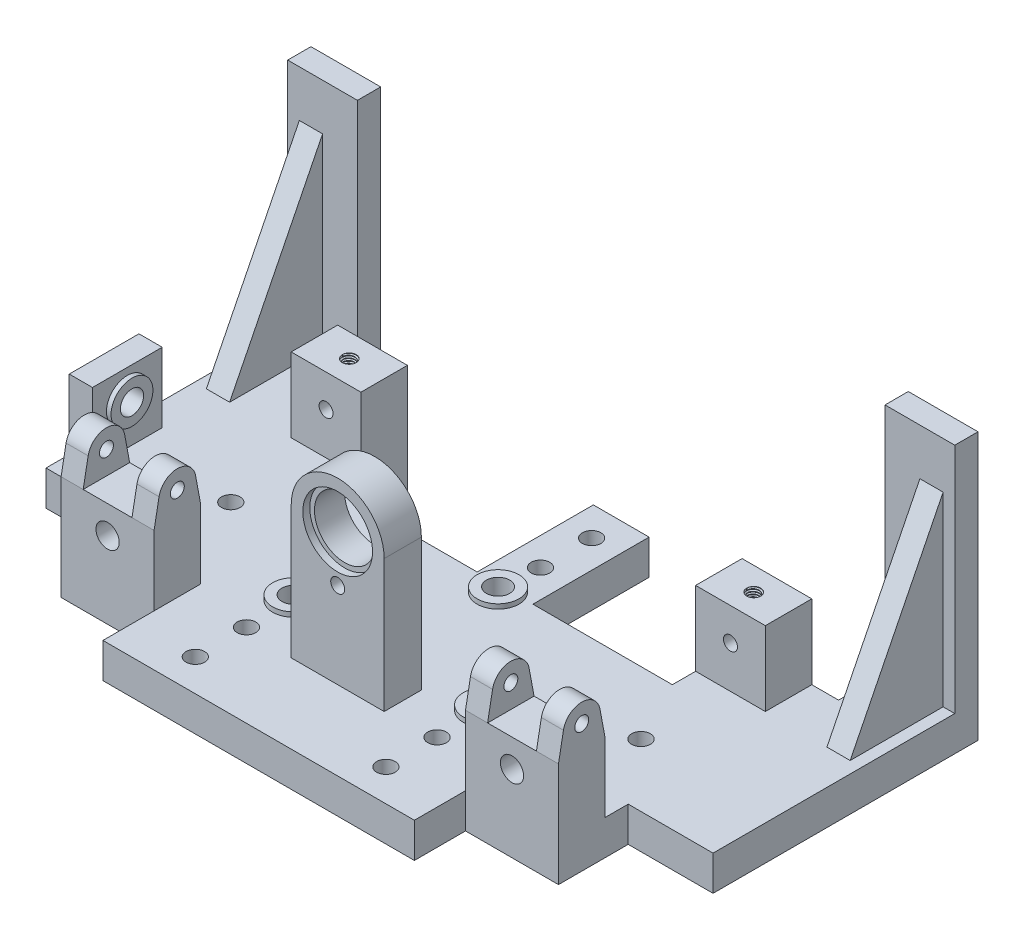
from build123d import *
from build123d.topology import SkipClean

# Parameters (mm, degrees)
EXTRUDE_1_DEPTH          = 15
SKETCH_3_W               = 10
SKETCH_3_H               = 30
EXTRUDE_2_DEPTH          = 30
SKETCH_5_W               = 40
SKETCH_5_H               = 20
EXTRUDE_3_DEPTH          = 30
SKETCH_2_R               = 5
CUT_EXTRUDE_1_DEPTH      = 13
CUT_EXTRUDE_2_REACH      = 323.076
SKETCH_4_R               = 5
CUT_EXTRUDE_3_REACH      = 190.715
SKETCH_6_R               = 5
EXTRUDE_START            = 2
SKETCH_7_R               = 9
SKETCH_7_R_2             = 5
EXTRUDE_4_DEPTH          = 2
SKETCH_8_R               = 9
SKETCH_8_R_2             = 5
EXTRUDE_5_DEPTH          = 2
SKETCH_9_R               = 9
SKETCH_9_R_2             = 5
EXTRUDE_6_DEPTH          = 2
SKETCH_11_W              = 40
SKETCH_11_H              = 16
EXTRUDE_7_DEPTH          = 57
SKETCH_12_W              = 20
SKETCH_12_H              = 16
REVOLVE_1_ANGLE          = 180
CUT_EXTRUDE_5_DEPTH      = 210.619297776
CUT_EXTRUDE_5_DEPTH_BACK = 3
SKETCH_13_R              = 15
CUT_EXTRUDE_6_REACH      = 209.888
SKETCH_14_R              = 13
SKETCH_15_R              = 3
CUT_EXTRUDE_7_DEPTH      = 12
SKETCH_10_R              = 4
CUT_EXTRUDE_4_DEPTH      = 226.51552053
EXTRUDE_8_DEPTH          = 40
CUT_EXTRUDE_8_REACH      = 251.153
SKETCH_17_W              = 20
SKETCH_17_H              = 21
SKETCH_18_R              = 3
CUT_EXTRUDE_9_DEPTH      = 40
SKETCH_19_W              = 30
SKETCH_19_H              = 20
EXTRUDE_9_DEPTH          = 32
SKETCH_20_R              = 3
CUT_EXTRUDE_10_DEPTH     = 20
SKETCH_21_W              = 30
SKETCH_21_H              = 15
EXTRUDE_10_DEPTH         = 30
SKETCH_22_W              = 30
SKETCH_22_H              = 10
EXTRUDE_11_DEPTH         = 100
SKETCH_24_R              = 3
CUT_EXTRUDE_12_DEPTH     = 10
RIB_1_REACH              = 344.797
SKETCH_25_WALL_W         = 777.037351518
SKETCH_25_WALL_H         = 10
THREAD_1_PITCH           = 1
THREAD_2_PITCH           = 1


with BuildPart() as part:
    # Sketch 1 → 凸台-拉伸1 (new body)
    with BuildSketch(Plane(origin=(0, 0, 0), x_dir=(1, 0, 0), z_dir=(0, 1, 0))):
        Polygon((-67, 0), (67, 0), (67, 22), (107, 22), (107, 52), (143.5, 52), (143.5, 136), (72, 136), (72, 106), (12, 106), (12, 156), (-12, 156), (-12, 106), (-72, 106), (-72, 136), (-143.5, 136), (-143.5, 52), (-107, 52), (-107, 22), (-67, 22), align=None)
    extrude(amount=EXTRUDE_1_DEPTH)

    # 草图3 → 凸台-拉伸2 (add)
    with BuildSketch(Plane(origin=(0, 15, 0), x_dir=(1, 0, 0), z_dir=(0, 1, 0))):
        with Locations((-138.5, 77)):
            Rectangle(SKETCH_3_W, SKETCH_3_H)
    extrude(amount=EXTRUDE_2_DEPTH)

    # 草图5 → 凸台-拉伸3 (add)
    with BuildSketch(Plane(origin=(0, 15, 0), x_dir=(1, 0, 0), z_dir=(0, 1, 0))):
        with Locations((-87, 32)):
            Rectangle(SKETCH_5_W, SKETCH_5_H)
        with Locations((87, 32)):
            Rectangle(SKETCH_5_W, SKETCH_5_H)
    extrude(amount=EXTRUDE_3_DEPTH)

    # Sketch 2 → 切除-拉伸1 (cut)
    with BuildSketch(Plane(origin=(0, 15, 0), x_dir=(1, 0, 0), z_dir=(0, 1, 0))):
        with Locations(Location((0, 103, 0), (0, 0, 270))):
            Circle(SKETCH_2_R)
        with Locations(Location((-41, 56, 0), (0, 0, 270))):
            Circle(SKETCH_2_R)
        with Locations(Location((41, 56, 0), (0, 0, 270))):
            Circle(SKETCH_2_R)
    extrude(amount=-CUT_EXTRUDE_1_DEPTH, mode=Mode.SUBTRACT)

    # 草图4 → 切除-拉伸2 (cut, up to next)
    with BuildSketch(Plane(origin=(-133.5, 0, 0), x_dir=(0, 0, -1), z_dir=(1, 0, 0)), mode=Mode.PRIVATE) as cut_extrude_2_sk1:
        with Locations((77, 33)):
            Circle(SKETCH_4_R)
    cut_extrude_2_tool1 = extrude(cut_extrude_2_sk1.sketch, amount=-CUT_EXTRUDE_2_REACH, mode=Mode.PRIVATE) & part.part
    add(cut_extrude_2_tool1.solids().sort_by_distance((-133.5, 33, -77))[0], mode=Mode.SUBTRACT)

    # 草图6 → 切除-拉伸3 (cut, up to next)
    with BuildSketch(Plane(origin=(0, 0, -42), x_dir=(-1, 0, 0), z_dir=(0, 0, -1)), mode=Mode.PRIVATE) as cut_extrude_3_sk1:
        with Locations((87, 33)):
            Circle(SKETCH_6_R)
    cut_extrude_3_tool1 = extrude(cut_extrude_3_sk1.sketch, amount=-CUT_EXTRUDE_3_REACH, mode=Mode.PRIVATE) & part.part
    # 草图6 → 切除-拉伸3 (cut, up to next)
    with BuildSketch(Plane(origin=(0, 0, -42), x_dir=(-1, 0, 0), z_dir=(0, 0, -1)), mode=Mode.PRIVATE) as cut_extrude_3_sk2:
        with Locations((-87, 33)):
            Circle(SKETCH_6_R)
    cut_extrude_3_tool2 = extrude(cut_extrude_3_sk2.sketch, amount=-CUT_EXTRUDE_3_REACH, mode=Mode.PRIVATE) & part.part
    add(cut_extrude_3_tool1.solids().sort_by_distance((-87, 33, -42))[0], mode=Mode.SUBTRACT)
    add(cut_extrude_3_tool2.solids().sort_by_distance((87, 33, -42))[0], mode=Mode.SUBTRACT)

    # 草图7 → 凸台-拉伸4 (add)
    with BuildSketch(Plane(origin=(-133.5, 0, 0), x_dir=(0, 0, -1), z_dir=(1, 0, 0)).offset(EXTRUDE_START)):
        with Locations(Location((77, 33, 0), (0, 0, 180))):
            Circle(SKETCH_7_R)
        with Locations((77, 33)):
            Circle(SKETCH_7_R_2, mode=Mode.SUBTRACT)
    extrude(amount=-EXTRUDE_4_DEPTH)

    # 草图8 → 凸台-拉伸5 (add)
    # profile 1 of 2: a face of its own
    with BuildSketch(Plane(origin=(0, 0, -42), x_dir=(-1, 0, 0), z_dir=(0, 0, -1)).offset(EXTRUDE_START)):
        with Locations(Location((-87, 33, 0), (0, 0, 180))):
            Circle(SKETCH_8_R)
        with Locations((-87, 33)):
            Circle(SKETCH_8_R_2, mode=Mode.SUBTRACT)
    # profile 2 of 2: a face of its own
    with BuildSketch(Plane(origin=(0, 0, -42), x_dir=(-1, 0, 0), z_dir=(0, 0, -1)).offset(EXTRUDE_START)):
        with Locations(Location((87, 33, 0), (0, 0, 180))):
            Circle(SKETCH_8_R)
        with Locations((87, 33)):
            Circle(SKETCH_8_R_2, mode=Mode.SUBTRACT)
    extrude(amount=-EXTRUDE_5_DEPTH)

    # 草图9 → 凸台-拉伸6 (add)
    # profile 1 of 3: a face of its own
    with BuildSketch(Plane(origin=(0, 15, 0), x_dir=(1, 0, 0), z_dir=(0, 1, 0)).offset(EXTRUDE_START)):
        with Locations(Location((-41, 56, 0), (0, 0, 90))):
            Circle(SKETCH_9_R)
        with Locations(Location((-41, 56, 0), (0, 0, 270))):
            Circle(SKETCH_9_R_2, mode=Mode.SUBTRACT)
    # profile 2 of 3: a face of its own
    with BuildSketch(Plane(origin=(0, 15, 0), x_dir=(1, 0, 0), z_dir=(0, 1, 0)).offset(EXTRUDE_START)):
        with Locations(Location((0, 103, 0), (0, 0, 90))):
            Circle(SKETCH_9_R)
        with Locations(Location((0, 103, 0), (0, 0, 270))):
            Circle(SKETCH_9_R_2, mode=Mode.SUBTRACT)
    # profile 3 of 3: a face of its own
    with BuildSketch(Plane(origin=(0, 15, 0), x_dir=(1, 0, 0), z_dir=(0, 1, 0)).offset(EXTRUDE_START)):
        with Locations(Location((41, 56, 0), (0, 0, 90))):
            Circle(SKETCH_9_R)
        with Locations(Location((41, 56, 0), (0, 0, 270))):
            Circle(SKETCH_9_R_2, mode=Mode.SUBTRACT)
    extrude(amount=-EXTRUDE_6_DEPTH)

    # 草图11 → 凸台-拉伸7 (add)
    with BuildSketch(Plane(origin=(0, 15, 0), x_dir=(1, 0, 0), z_dir=(0, 1, 0))):
        with Locations((0, 42)):
            Rectangle(SKETCH_11_W, SKETCH_11_H)
    extrude(amount=EXTRUDE_7_DEPTH)

    # 草图12 → 旋转1 (revolve)
    with BuildSketch(Plane(origin=(0, 72, 0), x_dir=(1, 0, 0), z_dir=(0, 1, 0))):
        with Locations((-10, 42)):
            Rectangle(SKETCH_12_W, SKETCH_12_H)
    revolve(axis=Axis((0, 72, -50), (0, 0, -1)), revolution_arc=REVOLVE_1_ANGLE)

    # 草图13 → 切除-拉伸5 (cut, two sides: drawn at the far end of the back side and taken through both)
    with BuildSketch(Plane.XY.offset(-34).offset(-CUT_EXTRUDE_5_DEPTH_BACK)):
        with Locations(Location((0, 72, 0), (0, 0, 180))):
            Circle(SKETCH_13_R)
    extrude(amount=CUT_EXTRUDE_5_DEPTH + CUT_EXTRUDE_5_DEPTH_BACK, mode=Mode.SUBTRACT)

    # 草图14 → 切除-拉伸6 (cut, up to next)
    with BuildSketch(Plane.XY.offset(-37), mode=Mode.PRIVATE) as cut_extrude_6_sk1:
        with Locations((0, 72)):
            Circle(SKETCH_14_R)
    cut_extrude_6_tool1 = extrude(cut_extrude_6_sk1.sketch, amount=-CUT_EXTRUDE_6_REACH, mode=Mode.PRIVATE) & part.part
    add(cut_extrude_6_tool1.solids().sort_by_distance((0, 72, -37))[0], mode=Mode.SUBTRACT)

    # 草图15 → 切除-拉伸7 (cut)
    with BuildSketch(Plane.XY.offset(-34)):
        with Locations((0, 52)):
            Circle(SKETCH_15_R)
    extrude(amount=-CUT_EXTRUDE_7_DEPTH, mode=Mode.SUBTRACT)

    # 草图10 → 切除-拉伸4 (cut, through all)
    with BuildSketch(Plane(origin=(0, 15, 0), x_dir=(1, 0, 0), z_dir=(0, 1, 0))):
        with Locations(Location((-41, 35.75, 0), (0, 0, 270))):
            Circle(SKETCH_10_R)
        with Locations(Location((41, 35.75, 0), (0, 0, 270))):
            Circle(SKETCH_10_R)
        with Locations(Location((-41, 13.75, 0), (0, 0, 270))):
            Circle(SKETCH_10_R)
        with Locations(Location((41, 13.75, 0), (0, 0, 270))):
            Circle(SKETCH_10_R)
        with Locations(Location((-91, 79, 0), (0, 0, 270))):
            Circle(SKETCH_10_R)
        with Locations(Location((0, 121.25, 0), (0, 0, 270))):
            Circle(SKETCH_10_R)
        with Locations(Location((0, 143.25, 0), (0, 0, 270))):
            Circle(SKETCH_10_R)
        with Locations(Location((85.5, 79, 0), (0, 0, 270))):
            Circle(SKETCH_10_R)
    extrude(amount=-CUT_EXTRUDE_4_DEPTH, mode=Mode.SUBTRACT)

    # 草图16 → 凸台-拉伸8 (add)
    with BuildSketch(Plane(origin=(107, 0, 0), x_dir=(0, 0, -1), z_dir=(1, 0, 0))):
        with BuildLine():
            Line((22, 45), (24.135238484, 56.464761516))
            ThreePointArc((24.135238484, 56.464761516), (32, 63), (39.864761516, 56.464761516))
            Line((39.864761516, 56.464761516), (42, 45))
            Line((42, 45), (22, 45))
        make_face()
    extrude_8 = extrude(amount=-EXTRUDE_8_DEPTH)

    # 草图17 → 切除-拉伸8 (cut, up to next)
    with BuildSketch(Plane(origin=(45, 45, 0), x_dir=(0, 0, -1), z_dir=(0, -1, 0)), mode=Mode.PRIVATE) as cut_extrude_8_sk1:
        with Locations((32, 42)):
            Rectangle(SKETCH_17_W, SKETCH_17_H)
    cut_extrude_8_tool1 = extrude(cut_extrude_8_sk1.sketch, amount=-CUT_EXTRUDE_8_REACH, mode=Mode.PRIVATE) & part.part
    cut_extrude_8 = cut_extrude_8_tool1.solids().sort_by_distance((87, 45, -32))[0]
    add(cut_extrude_8, mode=Mode.SUBTRACT)

    # 草图18 → 切除-拉伸9 (cut)
    with BuildSketch(Plane(origin=(107, 0, 0), x_dir=(0, 0, -1), z_dir=(1, 0, 0))):
        with Locations((32, 55)):
            Circle(SKETCH_18_R)
    cut_extrude_9 = extrude(amount=-CUT_EXTRUDE_9_DEPTH, mode=Mode.SUBTRACT)

    # 镜向1: 凸台-拉伸8, 切除-拉伸8, 切除-拉伸9 across plane
    add(extrude_8.mirror(Plane(origin=(0, 0, 0), x_dir=(0, 0, 1), z_dir=(1, 0, 0))))
    add(cut_extrude_8.mirror(Plane(origin=(0, 0, 0), x_dir=(0, 0, 1), z_dir=(1, 0, 0))), mode=Mode.SUBTRACT)
    add(cut_extrude_9.mirror(Plane(origin=(0, 0, 0), x_dir=(0, 0, 1), z_dir=(1, 0, 0))), mode=Mode.SUBTRACT)

    # 草图19 → 凸台-拉伸9 (add)
    with BuildSketch(Plane(origin=(0, 15, 0), x_dir=(1, 0, 0), z_dir=(0, 1, 0))):
        with Locations((-87, 126)):
            Rectangle(SKETCH_19_W, SKETCH_19_H)
        with Locations((87, 126)):
            Rectangle(SKETCH_19_W, SKETCH_19_H)
    extrude(amount=EXTRUDE_9_DEPTH)

    # 草图20 → 切除-拉伸10 (cut)
    with BuildSketch(Plane(origin=(0, 0, -136), x_dir=(-1, 0, 0), z_dir=(0, 0, -1))):
        with Locations((-87, 33)):
            Circle(SKETCH_20_R)
        with Locations((87, 33)):
            Circle(SKETCH_20_R)
    extrude(amount=-CUT_EXTRUDE_10_DEPTH, mode=Mode.SUBTRACT)

    # 草图21 → 凸台-拉伸10 (add)
    with BuildSketch(Plane(origin=(0, 0, -136), x_dir=(-1, 0, 0), z_dir=(0, 0, -1))):
        with Locations((-128.5, 7.5)):
            Rectangle(SKETCH_21_W, SKETCH_21_H)
        with Locations((128.5, 7.5)):
            Rectangle(SKETCH_21_W, SKETCH_21_H)
    extrude(amount=EXTRUDE_10_DEPTH)

    # 草图22 → 凸台-拉伸11 (add)
    with BuildSketch(Plane(origin=(0, 15, 0), x_dir=(1, 0, 0), z_dir=(0, 1, 0))):
        with Locations((-128.5, 161)):
            Rectangle(SKETCH_22_W, SKETCH_22_H)
        with Locations((128.5, 161)):
            Rectangle(SKETCH_22_W, SKETCH_22_H)
    extrude(amount=EXTRUDE_11_DEPTH)

    # 草图24 → 切除-拉伸12 (cut)
    with BuildSketch(Plane(origin=(0, 47, 0), x_dir=(1, 0, 0), z_dir=(0, 1, 0))):
        with Locations(Location((-87, 126, 0), (0, 0, 270))):
            Circle(SKETCH_24_R)
        with Locations(Location((87, 126, 0), (0, 0, 270))):
            Circle(SKETCH_24_R)
    extrude(amount=-CUT_EXTRUDE_12_DEPTH, mode=Mode.SUBTRACT)

    # 草图25 wall → 筋1 (add, up to next)
    with BuildSketch(Plane(origin=(133.5, 55, -136), x_dir=(0, -0.894427191, 0.4472135955), z_dir=(0, -0.4472135955, -0.894427191)), mode=Mode.PRIVATE) as rib_1_sk1:
        Rectangle(SKETCH_25_WALL_W, SKETCH_25_WALL_H)
    rib_1_tool1 = extrude(rib_1_sk1.sketch, amount=RIB_1_REACH, mode=Mode.PRIVATE) - part.part
    rib_1 = rib_1_tool1.solids().sort_by_distance((133.5, 55, -136))[0]
    add(rib_1)

    # 镜向2: 筋1 across plane
    add(rib_1.mirror(Plane(origin=(0, 0, 0), x_dir=(0, 0, 1), z_dir=(1, 0, 0))))

    # 螺纹线1: the profile of Sketch 1 2 profile screwed along a right-hand helix of 8 turns, 8 arcs to a turn; built about Z, then put on its axis
    with SkipClean():  # the faces are left unmerged after this step: merging them gives an invalid solid
        thread_1_z = Axis((0, 0, 0), (0, 0, 1))
        thread_1_corners = [(3.0003, 0, -0.000173205), (3.0003, 0, 0.875173202), (2.458734125, 0, 0.562499999), (2.458734125, 0, 0.312499999)]
        with BuildLine(mode=Mode.PRIVATE) as thread_1_profile:
            Line(thread_1_corners[0], thread_1_corners[1])
            Line(thread_1_corners[1], thread_1_corners[2])
            Line(thread_1_corners[2], thread_1_corners[3])
            Line(thread_1_corners[3], thread_1_corners[0])
        thread_1_cap = Face(thread_1_profile.wire())
        thread_1_turn_angles = [0, 22.5, 45, 67.5, 90, 112.5, 135, 157.5, 180, 202.5, 225, 247.5, 270, 292.5, 315, 337.5, 360]
        thread_1_turn_weights = [1, 0.9238795325112867, 1, 0.9238795325112867, 1, 0.9238795325112867, 1, 0.9238795325112867, 1, 0.9238795325112867, 1, 0.9238795325112867, 1, 0.9238795325112867, 1, 0.9238795325112867, 1]
        thread_1_turn_rails = [Edge.make_bspline([Vector(p[0], p[1], 0).rotate(thread_1_z, thread_1_turn_angles[k]) / thread_1_turn_weights[k] + Vector(0, 0, p[2] + THREAD_1_PITCH * thread_1_turn_angles[k] / 360) for k in range(17)], [0, 0, 0, 1, 1, 2, 2, 3, 3, 4, 4, 5, 5, 6, 6, 7, 7, 8, 8, 8], 2, thread_1_turn_weights) for p in thread_1_corners]
        thread_1_turn_sides = [Face.make_surface_from_curves(thread_1_turn_rails[p[0]], thread_1_turn_rails[p[1]]) for p in [(0, 1), (1, 2), (2, 3), (3, 0)]]
        thread_1 = Plane(origin=(-87, 47, -126), x_dir=(-1, 0, 0), z_dir=(0, -1, 0)) * Solid(Shell([*[p.moved(Location((0, 0, THREAD_1_PITCH * i))) for i in range(8) for p in thread_1_turn_sides], thread_1_cap, thread_1_cap.rotate(thread_1_z, 2880).moved(Location((0, 0, THREAD_1_PITCH * 2880 / 360)))]))
        add(thread_1)

    # 螺纹线2: the profile of Sketch 2 2 profile screwed along a right-hand helix of 8 turns, 8 arcs to a turn; built about Z, then put on its axis
    with SkipClean():  # the faces are left unmerged after this step: merging them gives an invalid solid
        thread_2_z = Axis((0, 0, 0), (0, 0, 1))
        thread_2_corners = [(3.0003, 0, -0.000173205), (3.0003, 0, 0.875173202), (2.458734125, 0, 0.562499999), (2.458734125, 0, 0.312499999)]
        with BuildLine(mode=Mode.PRIVATE) as thread_2_profile:
            Line(thread_2_corners[0], thread_2_corners[1])
            Line(thread_2_corners[1], thread_2_corners[2])
            Line(thread_2_corners[2], thread_2_corners[3])
            Line(thread_2_corners[3], thread_2_corners[0])
        thread_2_cap = Face(thread_2_profile.wire())
        thread_2_turn_angles = [0, 22.5, 45, 67.5, 90, 112.5, 135, 157.5, 180, 202.5, 225, 247.5, 270, 292.5, 315, 337.5, 360]
        thread_2_turn_weights = [1, 0.9238795325112867, 1, 0.9238795325112867, 1, 0.9238795325112867, 1, 0.9238795325112867, 1, 0.9238795325112867, 1, 0.9238795325112867, 1, 0.9238795325112867, 1, 0.9238795325112867, 1]
        thread_2_turn_rails = [Edge.make_bspline([Vector(p[0], p[1], 0).rotate(thread_2_z, thread_2_turn_angles[k]) / thread_2_turn_weights[k] + Vector(0, 0, p[2] + THREAD_2_PITCH * thread_2_turn_angles[k] / 360) for k in range(17)], [0, 0, 0, 1, 1, 2, 2, 3, 3, 4, 4, 5, 5, 6, 6, 7, 7, 8, 8, 8], 2, thread_2_turn_weights) for p in thread_2_corners]
        thread_2_turn_sides = [Face.make_surface_from_curves(thread_2_turn_rails[p[0]], thread_2_turn_rails[p[1]]) for p in [(0, 1), (1, 2), (2, 3), (3, 0)]]
        thread_2 = Plane(origin=(87, 47, -126), x_dir=(-1, 0, 0), z_dir=(0, -1, 0)) * Solid(Shell([*[p.moved(Location((0, 0, THREAD_2_PITCH * i))) for i in range(8) for p in thread_2_turn_sides], thread_2_cap, thread_2_cap.rotate(thread_2_z, 2880).moved(Location((0, 0, THREAD_2_PITCH * 2880 / 360)))]))
        add(thread_2)


solid = part.part
